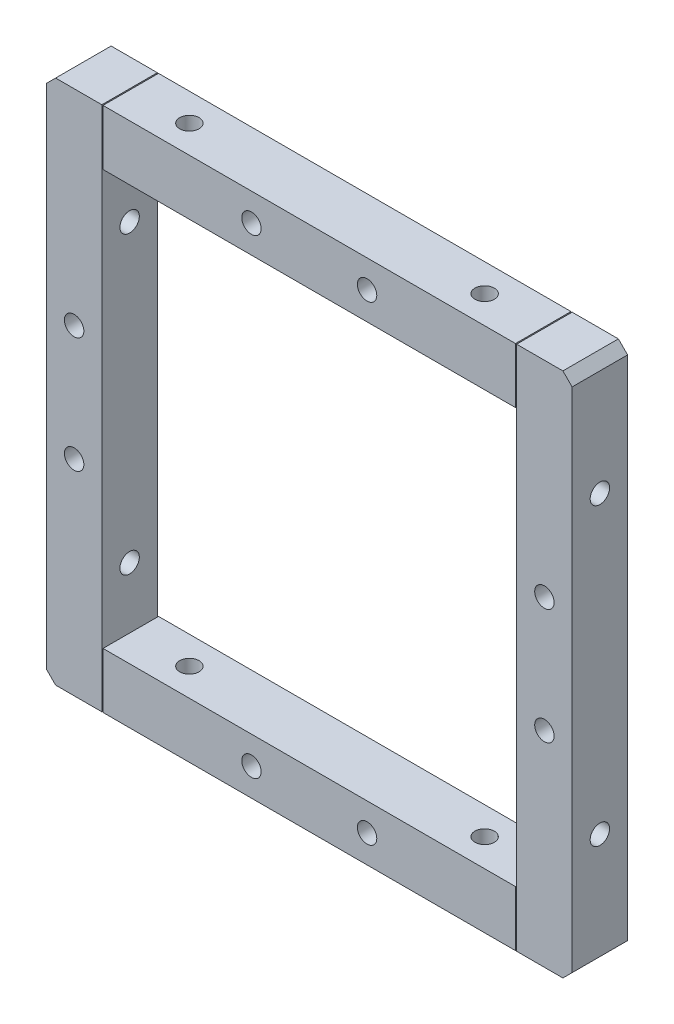
from build123d import *

# Parameters (mm, degrees)
SKETCH9_W                            = 12
SKETCH9_H                            = 113.7
BOSS_EXTRUDE2_DEPTH                  = 12
F_4_2_4_2_DIAMETER_HOLE3_D           = 4.2
F_4_2_4_2_DIAMETER_HOLE4_D           = 4.2
CHAMFER1_SIZE                        = 2
SKETCH15_W                           = 12
SKETCH15_H                           = 113.7
BOSS_EXTRUDE3_DEPTH                  = 12
SKETCH16_W                           = 2.1
SKETCH16_H                           = 113.7
F_4_2_4_2_DIAMETER_HOLE5_AT_2_COUNT  = 2
F_4_2_4_2_DIAMETER_HOLE5_AT_2_PITCH  = 63.85
SKETCH18_W                           = 2.1
SKETCH18_H                           = 12
F_4_2_4_2_DIAMETER_HOLE6_AT_2_COUNT  = 2
F_4_2_4_2_DIAMETER_HOLE6_AT_2_PITCH  = 25
CHAMFER2_SIZE                        = 2
SKETCH21_W                           = 89.2
SKETCH21_H                           = 12
BOSS_EXTRUDE4_DEPTH                  = 12
SKETCH22_W                           = 2.1
SKETCH22_H                           = 113.7
F_4_2_4_2_DIAMETER_HOLE7_AT_2_COUNT  = 2
F_4_2_4_2_DIAMETER_HOLE7_AT_2_PITCH  = 63.85
SKETCH24_W                           = 2.1
SKETCH24_H                           = 12
F_4_2_4_2_DIAMETER_HOLE8_AT_2_COUNT  = 2
F_4_2_4_2_DIAMETER_HOLE8_AT_2_PITCH  = 25
SKETCH30_W                           = 89.2
SKETCH30_H                           = 12
BOSS_EXTRUDE5_DEPTH                  = 12
SKETCH31_W                           = 2.1
SKETCH31_H                           = 113.7
F_4_2_4_2_DIAMETER_HOLE9_AT_2_COUNT  = 2
F_4_2_4_2_DIAMETER_HOLE9_AT_2_PITCH  = 63.85
SKETCH33_W                           = 2.1
SKETCH33_H                           = 12
F_4_2_4_2_DIAMETER_HOLE10_AT_2_COUNT = 2
F_4_2_4_2_DIAMETER_HOLE10_AT_2_PITCH = 25


with BuildPart() as part:
    # Sketch9 → Boss-Extrude2 (new body)
    with BuildSketch(Plane(origin=(113.7, 0, 0), x_dir=(0, 0, -1), z_dir=(1, 0, 0))):
        with Locations((6, -56.85)):
            Rectangle(SKETCH9_W, SKETCH9_H)
    extrude(amount=-BOSS_EXTRUDE2_DEPTH)

    # Ø4.2 (4.2) Diameter Hole3 (through all)
    with Locations(Plane(origin=(113.7, 0, 0), x_dir=(0, 0, -1), z_dir=(1, 0, 0))):
        with Locations((6, -88.775), (6, -24.925)):
            Hole(F_4_2_4_2_DIAMETER_HOLE3_D / 2)

    # Ø4.2 (4.2) Diameter Hole4 (through all)
    with Locations(Plane.XY):
        with Locations((107.7, -69.35), (107.7, -44.35)):
            Hole(F_4_2_4_2_DIAMETER_HOLE4_D / 2)

    # Chamfer1
    chamfer1_edges = [part.edges().sort_by_distance(p)[0] for p in [
        (113.7, 0, -6),
        (113.7, -113.7, -6),
    ]]
    chamfer(chamfer1_edges, length=CHAMFER1_SIZE)


with BuildPart() as body_2:
    # Sketch15 → Boss-Extrude3 (new body)
    with BuildSketch(Plane.XY):
        with Locations((6, -56.85)):
            Rectangle(SKETCH15_W, SKETCH15_H)
    extrude(amount=-BOSS_EXTRUDE3_DEPTH)

    # Sketch16 → Ø4.2 (4.2) Diameter Hole5 (revolve, cut)
    with BuildSketch(Plane(origin=(0, -88.775, -6), x_dir=(0, 0, 1), z_dir=(0, 1, 0))):
        with Locations((1.05, 56.85)):
            Rectangle(SKETCH16_W, SKETCH16_H)
    f_4_2_4_2_diameter_hole5 = revolve(axis=Axis((-6.35, -88.775, -6), (1, 0, 0)), mode=Mode.SUBTRACT)

    # Ø4.2 (4.2) Diameter Hole5 at 2: Ø4.2 (4.2) Diameter Hole5 ×2
    with Locations(*[(0, i * F_4_2_4_2_DIAMETER_HOLE5_AT_2_PITCH, 0) for i in range(1, F_4_2_4_2_DIAMETER_HOLE5_AT_2_COUNT)]):
        add(f_4_2_4_2_diameter_hole5, mode=Mode.SUBTRACT)

    # Sketch18 → Ø4.2 (4.2) Diameter Hole6 (revolve, cut)
    with BuildSketch(Plane(origin=(6, -44.35, 0), x_dir=(0, -1, 0), z_dir=(1, 0, 0))):
        with Locations((1.05, 6)):
            Rectangle(SKETCH18_W, SKETCH18_H)
    f_4_2_4_2_diameter_hole6 = revolve(axis=Axis((6, -44.35, 6.35), (0, 0, -1)), mode=Mode.SUBTRACT)

    # Ø4.2 (4.2) Diameter Hole6 at 2: Ø4.2 (4.2) Diameter Hole6 ×2
    with Locations(*[(0, -i * F_4_2_4_2_DIAMETER_HOLE6_AT_2_PITCH, 0) for i in range(1, F_4_2_4_2_DIAMETER_HOLE6_AT_2_COUNT)]):
        add(f_4_2_4_2_diameter_hole6, mode=Mode.SUBTRACT)

    # Chamfer2
    chamfer2_edges = [body_2.edges().sort_by_distance(p)[0] for p in [
        (0, 0, -6),
        (0, -113.7, -6),
    ]]
    chamfer(chamfer2_edges, length=CHAMFER2_SIZE)


with BuildPart() as body_3:
    # Sketch21 → Boss-Extrude4 (new body)
    with BuildSketch(Plane.XY):
        with Locations((56.85, -6)):
            Rectangle(SKETCH21_W, SKETCH21_H)
    extrude(amount=-BOSS_EXTRUDE4_DEPTH)

    # Sketch22 → Ø4.2 (4.2) Diameter Hole7 (revolve, cut)
    with BuildSketch(Plane(origin=(24.925, 0, -6), x_dir=(0, 0, 1), z_dir=(1, 0, 0))):
        with Locations((1.05, 56.85)):
            Rectangle(SKETCH22_W, SKETCH22_H)
    f_4_2_4_2_diameter_hole7 = revolve(axis=Axis((24.925, 6.35, -6), (0, -1, 0)), mode=Mode.SUBTRACT)

    # Ø4.2 (4.2) Diameter Hole7 at 2: Ø4.2 (4.2) Diameter Hole7 ×2
    with Locations(*[(i * F_4_2_4_2_DIAMETER_HOLE7_AT_2_PITCH, 0, 0) for i in range(1, F_4_2_4_2_DIAMETER_HOLE7_AT_2_COUNT)]):
        add(f_4_2_4_2_diameter_hole7, mode=Mode.SUBTRACT)

    # Sketch24 → Ø4.2 (4.2) Diameter Hole8 (revolve, cut)
    with BuildSketch(Plane(origin=(44.35, -6, 0), x_dir=(0, -1, 0), z_dir=(1, 0, 0))):
        with Locations((1.05, 6)):
            Rectangle(SKETCH24_W, SKETCH24_H)
    f_4_2_4_2_diameter_hole8 = revolve(axis=Axis((44.35, -6, 6.35), (0, 0, -1)), mode=Mode.SUBTRACT)

    # Ø4.2 (4.2) Diameter Hole8 at 2: Ø4.2 (4.2) Diameter Hole8 ×2
    with Locations(*[(i * F_4_2_4_2_DIAMETER_HOLE8_AT_2_PITCH, 0, 0) for i in range(1, F_4_2_4_2_DIAMETER_HOLE8_AT_2_COUNT)]):
        add(f_4_2_4_2_diameter_hole8, mode=Mode.SUBTRACT)


with BuildPart() as body_4:
    # Sketch30 → Boss-Extrude5 (new body)
    with BuildSketch(Plane(origin=(0, -113.7, 0), x_dir=(-1, 0, 0), z_dir=(0, -1, 0))):
        with Locations((-56.85, 6)):
            Rectangle(SKETCH30_W, SKETCH30_H)
    extrude(amount=-BOSS_EXTRUDE5_DEPTH)

    # Sketch31 → Ø4.2 (4.2) Diameter Hole9 (revolve, cut)
    with BuildSketch(Plane(origin=(24.925, -113.7, -6), x_dir=(0, 0, -1), z_dir=(1, 0, 0))):
        with Locations((1.05, 56.85)):
            Rectangle(SKETCH31_W, SKETCH31_H)
    f_4_2_4_2_diameter_hole9 = revolve(axis=Axis((24.925, -120.05, -6), (0, 1, 0)), mode=Mode.SUBTRACT)

    # Ø4.2 (4.2) Diameter Hole9 at 2: Ø4.2 (4.2) Diameter Hole9 ×2
    with Locations(*[(i * F_4_2_4_2_DIAMETER_HOLE9_AT_2_PITCH, 0, 0) for i in range(1, F_4_2_4_2_DIAMETER_HOLE9_AT_2_COUNT)]):
        add(f_4_2_4_2_diameter_hole9, mode=Mode.SUBTRACT)

    # Sketch33 → Ø4.2 (4.2) Diameter Hole10 (revolve, cut)
    with BuildSketch(Plane(origin=(69.35, -107.7, 0), x_dir=(0, -1, 0), z_dir=(1, 0, 0))):
        with Locations((1.05, 6)):
            Rectangle(SKETCH33_W, SKETCH33_H)
    f_4_2_4_2_diameter_hole10 = revolve(axis=Axis((69.35, -107.7, 6.35), (0, 0, -1)), mode=Mode.SUBTRACT)

    # Ø4.2 (4.2) Diameter Hole10 at 2: Ø4.2 (4.2) Diameter Hole10 ×2
    with Locations(*[(-i * F_4_2_4_2_DIAMETER_HOLE10_AT_2_PITCH, 0, 0) for i in range(1, F_4_2_4_2_DIAMETER_HOLE10_AT_2_COUNT)]):
        add(f_4_2_4_2_diameter_hole10, mode=Mode.SUBTRACT)


solid = Compound([part.part, body_2.part, body_3.part, body_4.part])
